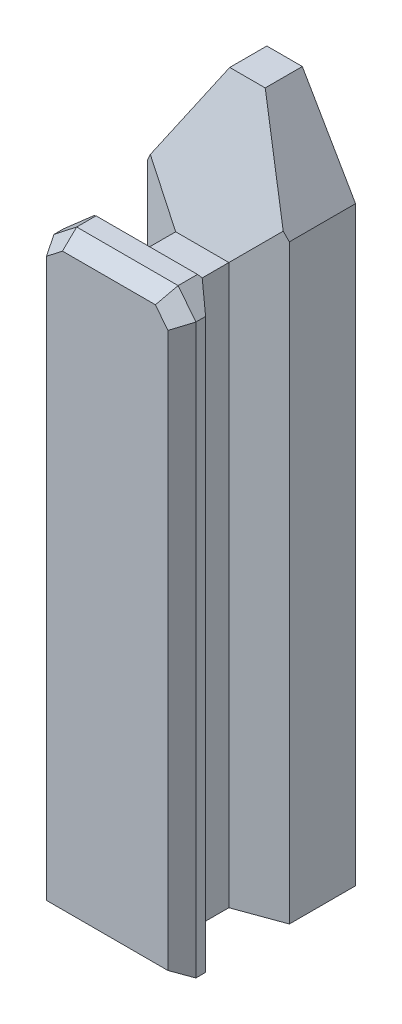
from build123d import *
from OCP.BRepFilletAPI import BRepFilletAPI_MakeChamfer

# Parameters (mm, degrees)
SKETCH1_W           = 16
SKETCH1_H           = 77
SKETCH1_R           = 1.5
BOSS_EXTRUDE1_DEPTH = 2
CHAMFER1_SIZE       = 6
CHAMFER1_SIZE2      = 10.392304845
SKETCH2_W           = 6
SKETCH2_H           = 63
BOSS_EXTRUDE2_DEPTH = 18
CHAMFER2_SIZE       = 20
CHAMFER2_SIZE_2     = 7.279404685
SKETCH3_W           = 16
SKETCH3_H           = 66.607695155
BOSS_EXTRUDE3_DEPTH = 3
CHAMFER3_SIZE       = 5.119766529
CHAMFER3_SIZE_2     = 4
CHAMFER4_SIZE       = 2
CHAMFER4_SIZE2      = 2.559883264
CHAMFER6_SIZE       = 2
CHAMFER6_SIZE2      = 1.154700538
CUT_EXTRUDE1_DEPTH  = 2.6
CUT_EXTRUDE3_DEPTH  = 3.1
SKETCH9_R           = 1.5
CUT_EXTRUDE_3_DEPTH = 6.5


with BuildPart() as part:
    # Sketch1 → Boss-Extrude1 (new body)
    with BuildSketch(Plane.XY):
        with Locations((0, 7.5)):
            Rectangle(SKETCH1_W, SKETCH1_H)
        with Locations((0, 30)):
            Circle(SKETCH1_R, mode=Mode.SUBTRACT)
        with Locations((0, -23)):
            Circle(SKETCH1_R, mode=Mode.SUBTRACT)
    extrude(amount=BOSS_EXTRUDE1_DEPTH)

    # Chamfer1
    chamfer1_edges = [part.edges().sort_by_distance(p)[0] for p in [
        (-8, 46, 1),
        (8, 46, 1),
    ]]
    chamfer1_side = [part.faces().sort_by_distance(p)[0] for p in [
        (0, 46, 1),
    ]]
    chamfer(chamfer1_edges, length=CHAMFER1_SIZE, length2=CHAMFER1_SIZE2, reference=chamfer1_side[0])

    # Sketch2 → Boss-Extrude2 (add)
    with BuildSketch(Plane.XY.offset(2)):
        with Locations((0, 0.5)):
            Rectangle(SKETCH2_W, SKETCH2_H)
    extrude(amount=BOSS_EXTRUDE2_DEPTH)

    # Chamfer2
    # the kernel refuses this chamfer: 20, 7.279404685 mm, written as the material it adds along each edge
    with BuildSketch(Plane(origin=(3, 32, 2), x_dir=(0.9999130865277317, 0, -0.013184058198645935), z_dir=(0, -1, 0))) as chamfer2_piece_1_section:
        Polygon((CHAMFER2_SIZE * 0.999913086528, CHAMFER2_SIZE * 0.0131840581986), (-CHAMFER2_SIZE_2 * 0.0131840581992, CHAMFER2_SIZE_2 * 0.999913086572), (0, 0), align=None)
    chamfer2_piece_1 = extrude(amount=63, mode=Mode.PRIVATE)
    chamfer2_piece_1 = split(chamfer2_piece_1, bisect_by=Plane(origin=(8, 0.5, 5.171623494), z_dir=(-1, 0, 0)), keep=Keep.TOP, mode=Mode.PRIVATE)
    add(chamfer2_piece_1)
    with BuildSketch(Plane(origin=(-3, -31, 2), x_dir=(-0.9999130865277317, 0, -0.013184058198645935), z_dir=(0, 1, 0))) as chamfer2_piece_2_section:
        Polygon((CHAMFER2_SIZE * 0.999913086528, CHAMFER2_SIZE * 0.0131840581986), (-CHAMFER2_SIZE_2 * 0.0131840581992, CHAMFER2_SIZE_2 * 0.999913086572), (0, 0), align=None)
    chamfer2_piece_2 = extrude(amount=63, mode=Mode.PRIVATE)
    chamfer2_piece_2 = split(chamfer2_piece_2, bisect_by=Plane(origin=(-8, 0.5, 5.171623494), z_dir=(1, 0, 0)), keep=Keep.TOP, mode=Mode.PRIVATE)
    add(chamfer2_piece_2)
    with BuildSketch(Plane(origin=(-3, 32, 2), x_dir=(0, 0.9999130865277315, -0.01318405819864593), z_dir=(1, 0, 0))) as chamfer2_piece_3_section:
        Polygon((CHAMFER2_SIZE * 0.999913086528, CHAMFER2_SIZE * 0.0131840581986), (-CHAMFER2_SIZE_2 * 0.0131840581992, CHAMFER2_SIZE_2 * 0.999913086572), (0, 0), align=None)
    chamfer2_piece_3 = extrude(amount=6, mode=Mode.PRIVATE)
    chamfer2_piece_3 = split(chamfer2_piece_3, bisect_by=Plane(origin=(0, 46, 4.508624661), z_dir=(0, -1, 0)), keep=Keep.TOP, mode=Mode.PRIVATE)
    chamfer2_piece_3 = split(chamfer2_piece_3, bisect_by=Plane(origin=(-5.203873062, 40.450729076, 4.508624661), z_dir=(0.8660254037844399, -0.49999999999999795, 0)), keep=Keep.TOP, mode=Mode.PRIVATE)
    chamfer2_piece_3 = split(chamfer2_piece_3, bisect_by=Plane(origin=(5.203873062, 40.450729076, 4.508624661), z_dir=(-0.8660254037844398, -0.499999999999998, 0)), keep=Keep.TOP, mode=Mode.PRIVATE)
    add(chamfer2_piece_3)
    with BuildSketch(Plane(origin=(-3, 32, 2), x_dir=(0, 0.9999130865277315, -0.01318405819864593), z_dir=(1, 0, 0))) as chamfer2_piece_4a_section:
        Polygon((CHAMFER2_SIZE * 0.999913086528, CHAMFER2_SIZE * 0.0131840581986), (-CHAMFER2_SIZE_2 * 0.0131840581992, CHAMFER2_SIZE_2 * 0.999913086572), (0, 0), align=None)
    chamfer2_piece_4a = extrude(amount=57.883894651, mode=Mode.PRIVATE)
    chamfer2_piece_4a = split(chamfer2_piece_4a, bisect_by=Plane(origin=(7.316315987, 36.791870601, 4.879553829), z_dir=(-0.8660254037844398, -0.499999999999998, 0)), keep=Keep.TOP, mode=Mode.PRIVATE)
    chamfer2_piece_4a = split(chamfer2_piece_4a, bisect_by=Plane(origin=(8, 35.552510025, 4.879553829), z_dir=(-1, 0, 0)), keep=Keep.TOP, mode=Mode.PRIVATE)
    chamfer2_piece_4a = split(chamfer2_piece_4a, bisect_by=Plane(origin=(3, 35.552510025, 4.879553829), z_dir=(1, 0, 0)), keep=Keep.TOP, mode=Mode.PRIVATE)
    with BuildSketch(Plane(origin=(3, 83.883894651, 2), x_dir=(0.9999130865277317, 0, -0.013184058198645935), z_dir=(0, -1, 0))) as chamfer2_piece_4b_section:
        Polygon((CHAMFER2_SIZE * 0.999913086528, CHAMFER2_SIZE * 0.0131840581986), (-CHAMFER2_SIZE_2 * 0.0131840581992, CHAMFER2_SIZE_2 * 0.999913086572), (0, 0), align=None)
    chamfer2_piece_4b = extrude(amount=114.883894651, mode=Mode.PRIVATE)
    chamfer2_piece_4b = split(chamfer2_piece_4b, bisect_by=Plane(origin=(6.651088561, 37.944078302, 5.319791994), z_dir=(-0.8660254037844398, -0.499999999999998, 0)), keep=Keep.TOP, mode=Mode.PRIVATE)
    chamfer2_piece_4b = split(chamfer2_piece_4b, bisect_by=Plane(origin=(8, 36.755262641, 5.319791994), z_dir=(-1, 0, 0)), keep=Keep.TOP, mode=Mode.PRIVATE)
    chamfer2_piece_4b = split(chamfer2_piece_4b, bisect_by=Plane(origin=(4.591999436, 32, 5.319791994), z_dir=(0, 1, 0)), keep=Keep.TOP, mode=Mode.PRIVATE)
    chamfer2_piece_4 = chamfer2_piece_4a & chamfer2_piece_4b
    add(chamfer2_piece_4)
    with BuildSketch(Plane(origin=(-3, -31, 2), x_dir=(-0.9999130865277317, 0, -0.013184058198645935), z_dir=(0, 1, 0))) as chamfer2_piece_5a_section:
        Polygon((CHAMFER2_SIZE * 0.999913086528, CHAMFER2_SIZE * 0.0131840581986), (-CHAMFER2_SIZE_2 * 0.0131840581992, CHAMFER2_SIZE_2 * 0.999913086572), (0, 0), align=None)
    chamfer2_piece_5a = extrude(amount=114.883894651, mode=Mode.PRIVATE)
    chamfer2_piece_5a = split(chamfer2_piece_5a, bisect_by=Plane(origin=(-6.651088561, 37.944078302, 5.319791994), z_dir=(0.8660254037844399, -0.49999999999999795, 0)), keep=Keep.TOP, mode=Mode.PRIVATE)
    chamfer2_piece_5a = split(chamfer2_piece_5a, bisect_by=Plane(origin=(-8, 36.755262641, 5.319791994), z_dir=(1, 0, 0)), keep=Keep.TOP, mode=Mode.PRIVATE)
    chamfer2_piece_5a = split(chamfer2_piece_5a, bisect_by=Plane(origin=(-4.591999436, 32, 5.319791994), z_dir=(0, 1, 0)), keep=Keep.TOP, mode=Mode.PRIVATE)
    with BuildSketch(Plane(origin=(-54.883894651, 32, 2), x_dir=(0, 0.9999130865277315, -0.01318405819864593), z_dir=(1, 0, 0))) as chamfer2_piece_5b_section:
        Polygon((CHAMFER2_SIZE * 0.999913086528, CHAMFER2_SIZE * 0.0131840581986), (-CHAMFER2_SIZE_2 * 0.0131840581992, CHAMFER2_SIZE_2 * 0.999913086572), (0, 0), align=None)
    chamfer2_piece_5b = extrude(amount=57.883894651, mode=Mode.PRIVATE)
    chamfer2_piece_5b = split(chamfer2_piece_5b, bisect_by=Plane(origin=(-7.316315987, 36.791870601, 4.879553829), z_dir=(0.8660254037844399, -0.49999999999999795, 0)), keep=Keep.TOP, mode=Mode.PRIVATE)
    chamfer2_piece_5b = split(chamfer2_piece_5b, bisect_by=Plane(origin=(-8, 35.552510025, 4.879553829), z_dir=(1, 0, 0)), keep=Keep.TOP, mode=Mode.PRIVATE)
    chamfer2_piece_5b = split(chamfer2_piece_5b, bisect_by=Plane(origin=(-3, 35.552510025, 4.879553829), z_dir=(-1, 0, 0)), keep=Keep.TOP, mode=Mode.PRIVATE)
    chamfer2_piece_5 = chamfer2_piece_5a & chamfer2_piece_5b
    add(chamfer2_piece_5)

    # Sketch3 → Boss-Extrude3 (add)
    with BuildSketch(Plane.XY.offset(20)):
        with Locations((0, 2.303847577)):
            Rectangle(SKETCH3_W, SKETCH3_H)
    extrude(amount=-BOSS_EXTRUDE3_DEPTH)

    # Chamfer3
    # the kernel refuses this chamfer: 5.119766529, 4 mm, written as the material it adds along each edge
    with BuildSketch(Plane(origin=(-3, 32, 17), x_dir=(-0.9997151392093142, 0, 0.023867141339117107), z_dir=(0, -1, 0))) as chamfer3_piece_1_section:
        Polygon((CHAMFER3_SIZE * 0.999715139165, CHAMFER3_SIZE * 0.0238671413381), (-CHAMFER3_SIZE_2 * 0.0238671413391, CHAMFER3_SIZE_2 * 0.999715139209), (0, 0), align=None)
    chamfer3_piece_1 = extrude(amount=63, mode=Mode.PRIVATE)
    chamfer3_piece_1 = split(chamfer3_piece_1, bisect_by=Plane(origin=(-8, 0.5, 15.68735559), z_dir=(1, 0, 0)), keep=Keep.TOP, mode=Mode.PRIVATE)
    add(chamfer3_piece_1)
    with BuildSketch(Plane(origin=(3, -31, 17), x_dir=(-0.03908161918057666, 0, -0.9992360216896831), z_dir=(0, 1, 0))) as chamfer3_piece_2_section:
        Polygon((CHAMFER3_SIZE_2 * 0.99923602169, -CHAMFER3_SIZE_2 * 0.0390816191806), (-CHAMFER3_SIZE * 0.0390816191788, -CHAMFER3_SIZE * 0.999236021645), (0, 0), align=None)
    chamfer3_piece_2 = extrude(amount=63, mode=Mode.PRIVATE)
    chamfer3_piece_2 = split(chamfer3_piece_2, bisect_by=Plane(origin=(8, 0.5, 15.68735559), z_dir=(-1, 0, 0)), keep=Keep.TOP, mode=Mode.PRIVATE)
    add(chamfer3_piece_2)
    with BuildSketch(Plane(origin=(3, 32, 17), x_dir=(0, -0.03908161918057696, -0.9992360216896828), z_dir=(-1, 0, 0))) as chamfer3_piece_3_section:
        Polygon((CHAMFER3_SIZE_2 * 0.99923602169, -CHAMFER3_SIZE_2 * 0.0390816191806), (-CHAMFER3_SIZE * 0.0390816191788, -CHAMFER3_SIZE * 0.999236021645), (0, 0), align=None)
    chamfer3_piece_3 = extrude(amount=6, mode=Mode.PRIVATE)
    chamfer3_piece_3 = split(chamfer3_piece_3, bisect_by=Plane(origin=(0, 35.607695155, 15.575763401), z_dir=(0, -1, 0)), keep=Keep.TOP, mode=Mode.PRIVATE)
    add(chamfer3_piece_3)
    with BuildSketch(Plane(origin=(3, 32, 17), x_dir=(0, -0.03908161918057696, -0.9992360216896828), z_dir=(-1, 0, 0))) as chamfer3_piece_4a_section:
        Polygon((CHAMFER3_SIZE_2 * 0.99923602169, -CHAMFER3_SIZE_2 * 0.0390816191806), (-CHAMFER3_SIZE * 0.0390816191788, -CHAMFER3_SIZE * 0.999236021645), (0, 0), align=None)
    chamfer3_piece_4a = extrude(amount=19.206621479, mode=Mode.PRIVATE)
    chamfer3_piece_4a = split(chamfer3_piece_4a, bisect_by=Plane(origin=(-3, 33.411290687, 15.575763401), z_dir=(-1, 0, 0)), keep=Keep.TOP, mode=Mode.PRIVATE)
    chamfer3_piece_4a = split(chamfer3_piece_4a, bisect_by=Plane(origin=(-8, 33.411290687, 15.575763401), z_dir=(1, 0, 0)), keep=Keep.TOP, mode=Mode.PRIVATE)
    chamfer3_piece_4a = split(chamfer3_piece_4a, bisect_by=Plane(origin=(-5.5, 35.607695155, 15.575763401), z_dir=(0, -1, 0)), keep=Keep.TOP, mode=Mode.PRIVATE)
    with BuildSketch(Plane(origin=(-3, 45.206621479, 17), x_dir=(-0.9997151392093142, 0, 0.023867141339117107), z_dir=(0, -1, 0))) as chamfer3_piece_4b_section:
        Polygon((CHAMFER3_SIZE * 0.999715139165, CHAMFER3_SIZE * 0.0238671413381), (-CHAMFER3_SIZE_2 * 0.0238671413391, CHAMFER3_SIZE_2 * 0.999715139209), (0, 0), align=None)
    chamfer3_piece_4b = extrude(amount=76.206621479, mode=Mode.PRIVATE)
    chamfer3_piece_4b = split(chamfer3_piece_4b, bisect_by=Plane(origin=(-4.682811334, 32, 15.68735559), z_dir=(0, 1, 0)), keep=Keep.TOP, mode=Mode.PRIVATE)
    chamfer3_piece_4b = split(chamfer3_piece_4b, bisect_by=Plane(origin=(-8, 33.803847577, 15.68735559), z_dir=(1, 0, 0)), keep=Keep.TOP, mode=Mode.PRIVATE)
    chamfer3_piece_4b = split(chamfer3_piece_4b, bisect_by=Plane(origin=(-4.682811334, 35.607695155, 15.68735559), z_dir=(0, -1, 0)), keep=Keep.TOP, mode=Mode.PRIVATE)
    chamfer3_piece_4 = chamfer3_piece_4a & chamfer3_piece_4b
    add(chamfer3_piece_4)
    with BuildSketch(Plane(origin=(3, -31, 17), x_dir=(-0.03908161918057666, 0, -0.9992360216896831), z_dir=(0, 1, 0))) as chamfer3_piece_5a_section:
        Polygon((CHAMFER3_SIZE_2 * 0.99923602169, -CHAMFER3_SIZE_2 * 0.0390816191806), (-CHAMFER3_SIZE * 0.0390816191788, -CHAMFER3_SIZE * 0.999236021645), (0, 0), align=None)
    chamfer3_piece_5a = extrude(amount=76.206621479, mode=Mode.PRIVATE)
    chamfer3_piece_5a = split(chamfer3_piece_5a, bisect_by=Plane(origin=(4.682811334, 32, 15.68735559), z_dir=(0, 1, 0)), keep=Keep.TOP, mode=Mode.PRIVATE)
    chamfer3_piece_5a = split(chamfer3_piece_5a, bisect_by=Plane(origin=(8, 33.803847577, 15.68735559), z_dir=(-1, 0, 0)), keep=Keep.TOP, mode=Mode.PRIVATE)
    chamfer3_piece_5a = split(chamfer3_piece_5a, bisect_by=Plane(origin=(4.682811334, 35.607695155, 15.68735559), z_dir=(0, -1, 0)), keep=Keep.TOP, mode=Mode.PRIVATE)
    with BuildSketch(Plane(origin=(16.206621479, 32, 17), x_dir=(0, -0.039081619180576975, -0.9992360216896828), z_dir=(-1, 0, 0))) as chamfer3_piece_5b_section:
        Polygon((CHAMFER3_SIZE_2 * 0.99923602169, -CHAMFER3_SIZE_2 * 0.0390816191806), (-CHAMFER3_SIZE * 0.0390816191788, -CHAMFER3_SIZE * 0.999236021645), (0, 0), align=None)
    chamfer3_piece_5b = extrude(amount=19.206621479, mode=Mode.PRIVATE)
    chamfer3_piece_5b = split(chamfer3_piece_5b, bisect_by=Plane(origin=(3, 33.411290687, 15.575763401), z_dir=(1, 0, 0)), keep=Keep.TOP, mode=Mode.PRIVATE)
    chamfer3_piece_5b = split(chamfer3_piece_5b, bisect_by=Plane(origin=(8, 33.411290687, 15.575763401), z_dir=(-1, 0, 0)), keep=Keep.TOP, mode=Mode.PRIVATE)
    chamfer3_piece_5b = split(chamfer3_piece_5b, bisect_by=Plane(origin=(5.5, 35.607695155, 15.575763401), z_dir=(0, -1, 0)), keep=Keep.TOP, mode=Mode.PRIVATE)
    chamfer3_piece_5 = chamfer3_piece_5a & chamfer3_piece_5b
    add(chamfer3_piece_5)

    # Chamfer4: one chamfer whose edges measure the first distance from different faces: ONE call of the kernel's chamfer builder (chamfer() names one face for all edges)
    chamfer4_edges_1 = [part.edges().sort_by_distance(p)[0] for p in [
        (8, 35.607695155, 18.453214066),
    ]]
    chamfer4_side_1 = [part.faces().sort_by_distance(p)[0] for p in [
        (0, 35.607695155, 17.949346945),
    ]]
    chamfer4_edges_2 = [part.edges().sort_by_distance(p)[0] for p in [
        (-8, 35.607695155, 18.453214066),
    ]]
    chamfer4_side_2 = [part.faces().sort_by_distance(p)[0] for p in [
        (-8, 2.303847577, 18.453214066),
    ]]
    chamfer4 = BRepFilletAPI_MakeChamfer(part.part.solid().wrapped)
    for e in chamfer4_edges_1:
        chamfer4.Add(CHAMFER4_SIZE, CHAMFER4_SIZE2, e.wrapped, chamfer4_side_1[0].wrapped)  # the first distance lies on this face
    for e in chamfer4_edges_2:
        chamfer4.Add(CHAMFER4_SIZE, CHAMFER4_SIZE2, e.wrapped, chamfer4_side_2[0].wrapped)  # the first distance lies on this face
    add(Compound.cast(chamfer4.Shape()), mode=Mode.REPLACE)

    # Chamfer6: one chamfer whose edges measure the first distance from different faces: ONE call of the kernel's chamfer builder (chamfer() names one face for all edges)
    chamfer6_edges_1 = [part.edges().sort_by_distance(p)[0] for p in [
        (0.279941632, 35.607695155, 20),
    ]]
    chamfer6_side_1 = [part.faces().sort_by_distance(p)[0] for p in [
        (0.279941632, 35.607695155, 17.909320185),
    ]]
    chamfer6_edges_2 = [part.edges().sort_by_distance(p)[0] for p in [
        (-8, 1.303847577, 20),
    ]]
    chamfer6_side_2 = [part.faces().sort_by_distance(p)[0] for p in [
        (-8, 1.303847577, 18.453214066),
    ]]
    chamfer6_edges_3 = [part.edges().sort_by_distance(p)[0] for p in [
        (-6.720058368, 34.607695155, 20),
    ]]
    chamfer6_side_3 = [part.faces().sort_by_distance(p)[0] for p in [
        (-6.643946015, 34.667160642, 17.986837594),
    ]]
    chamfer6_edges_4 = [part.edges().sort_by_distance(p)[0] for p in [
        (7, 34.327753522, 20),
    ]]
    chamfer6_side_4 = [part.faces().sort_by_distance(p)[0] for p in [
        (6.939737458, 34.404886058, 18.056606172),
    ]]
    chamfer6_edges_5 = [part.edges().sort_by_distance(p)[0] for p in [
        (0, -31, 20),
    ]]
    chamfer6_side_5 = [part.faces().sort_by_distance(p)[0] for p in [
        (0, -31, 9.550063224),
    ]]
    chamfer6_edges_6 = [part.edges().sort_by_distance(p)[0] for p in [
        (8, 1.023905945, 20),
    ]]
    chamfer6_side_6 = [part.faces().sort_by_distance(p)[0] for p in [
        (8, 1.023905945, 18.453214066),
    ]]
    chamfer6 = BRepFilletAPI_MakeChamfer(part.part.solid().wrapped)
    for e in chamfer6_edges_1:
        chamfer6.Add(CHAMFER6_SIZE, CHAMFER6_SIZE2, e.wrapped, chamfer6_side_1[0].wrapped)  # the first distance lies on this face
    for e in chamfer6_edges_2:
        chamfer6.Add(CHAMFER6_SIZE, CHAMFER6_SIZE2, e.wrapped, chamfer6_side_2[0].wrapped)  # the first distance lies on this face
    for e in chamfer6_edges_3:
        chamfer6.Add(CHAMFER6_SIZE, CHAMFER6_SIZE2, e.wrapped, chamfer6_side_3[0].wrapped)  # the first distance lies on this face
    for e in chamfer6_edges_4:
        chamfer6.Add(CHAMFER6_SIZE, CHAMFER6_SIZE2, e.wrapped, chamfer6_side_4[0].wrapped)  # the first distance lies on this face
    for e in chamfer6_edges_5:
        chamfer6.Add(CHAMFER6_SIZE, CHAMFER6_SIZE2, e.wrapped, chamfer6_side_5[0].wrapped)  # the first distance lies on this face
    for e in chamfer6_edges_6:
        chamfer6.Add(CHAMFER6_SIZE, CHAMFER6_SIZE2, e.wrapped, chamfer6_side_6[0].wrapped)  # the first distance lies on this face
    add(Compound.cast(chamfer6.Shape()), mode=Mode.REPLACE)

    # Sketch4 → Cut-Extrude1 (cut)
    with BuildSketch(Plane(origin=(0, 0, 1.5), x_dir=(-1, 0, 0), z_dir=(0, 0, -1))):
        Polygon((1.703183294, 32.95), (-1.703183294, 32.95), (-3.406366588, 30), (-1.703183294, 27.05), (1.703183294, 27.05), (10.550735488, 27.05), (10.550735488, 32.95), align=None)
        Polygon((1.703183294, -20.05), (-1.703183294, -20.05), (-3.406366588, -23), (-1.703183294, -25.95), (1.703183294, -25.95), (10.550735488, -25.95), (10.550735488, -20.05), align=None)
    extrude(amount=-CUT_EXTRUDE1_DEPTH, mode=Mode.SUBTRACT)

    # Sketch8 → Cut-Extrude3 (cut)
    with BuildSketch(Plane(origin=(0, -30, 0), x_dir=(-1, 0, 0), z_dir=(0, -1, 0))):
        with BuildLine():
            Line((-4.6, -4.7), (-4.6, 0))
            Line((-4.6, 0), (4.6, 0))
            Line((4.6, 0), (4.6, -4.7))
            ThreePointArc((4.6, -4.7), (0, -9.3), (-4.6, -4.7))
        make_face()
    extrude(amount=-CUT_EXTRUDE3_DEPTH, mode=Mode.SUBTRACT)

    # Sketch9 → Cut-Extrude 3 (cut)
    with BuildSketch(Plane(origin=(0, 0, 0), x_dir=(-1, 0, 0), z_dir=(0, 0, -1))):
        with Locations(Location((0, 30, 0), (0, 0, 180))):
            Circle(SKETCH9_R)
        with Locations(Location((0, -23, 0), (0, 0, 180))):
            Circle(SKETCH9_R)
    extrude(amount=-CUT_EXTRUDE_3_DEPTH, mode=Mode.SUBTRACT)


solid = part.part
